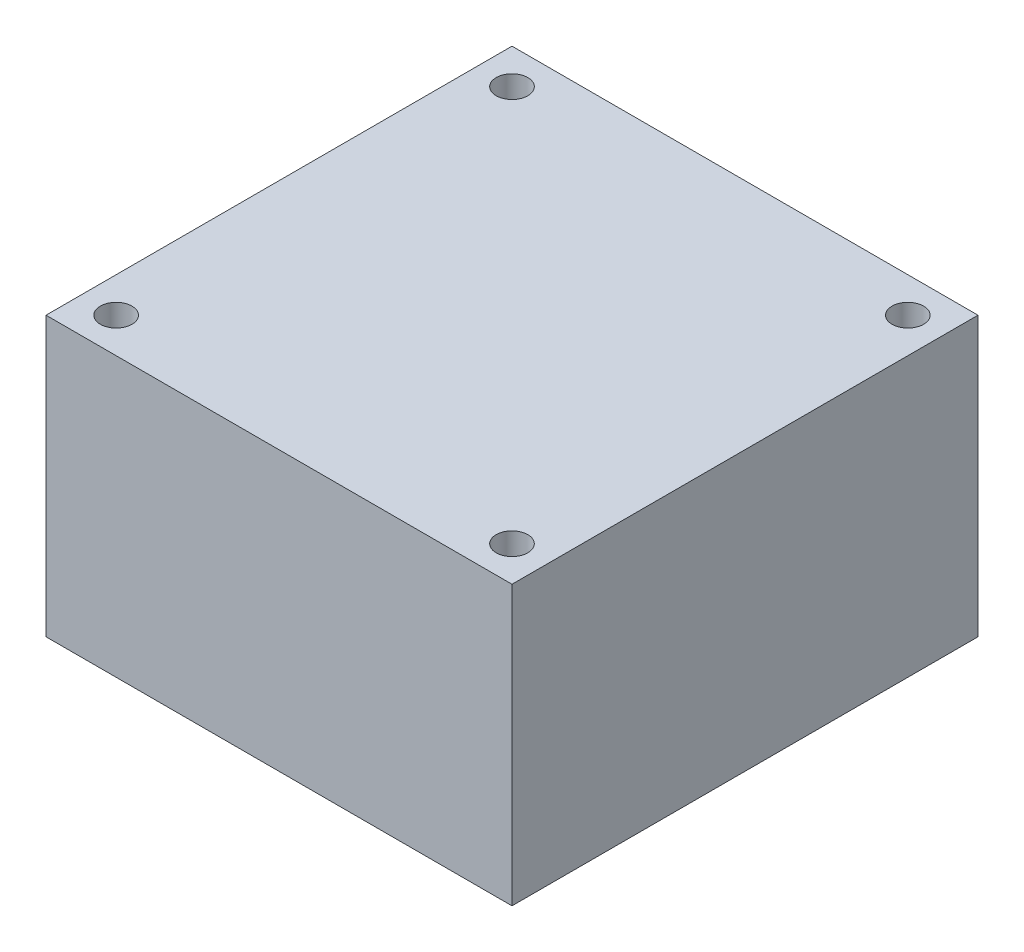
from build123d import *

# Parameters (mm, degrees)
SKETCH1_W           = 43.5
SKETCH1_H           = 43.5
BOSS_EXTRUDE1_DEPTH = 26
SKETCH2_R           = 1.475
CUT_EXTRUDE1_DEPTH  = 41.275612969


with BuildPart() as part:
    # Sketch1 → Boss-Extrude1 (new body)
    with BuildSketch(Plane(origin=(0, 0, 0), x_dir=(1, 0, 0), z_dir=(0, 1, 0))):
        Rectangle(SKETCH1_W, SKETCH1_H)
    extrude(amount=BOSS_EXTRUDE1_DEPTH)

    # Sketch2 → Cut-Extrude1 (cut, through all)
    with BuildSketch(Plane(origin=(0, 26, 0), x_dir=(1, 0, 0), z_dir=(0, 1, 0))):
        with Locations((-18.475, 18.475)):
            Circle(SKETCH2_R)
        with Locations((-18.475, -18.475)):
            Circle(SKETCH2_R)
        with Locations((18.475, -18.475)):
            Circle(SKETCH2_R)
        with Locations((18.475, 18.475)):
            Circle(SKETCH2_R)
    extrude(amount=-CUT_EXTRUDE1_DEPTH, mode=Mode.SUBTRACT)


solid = part.part
